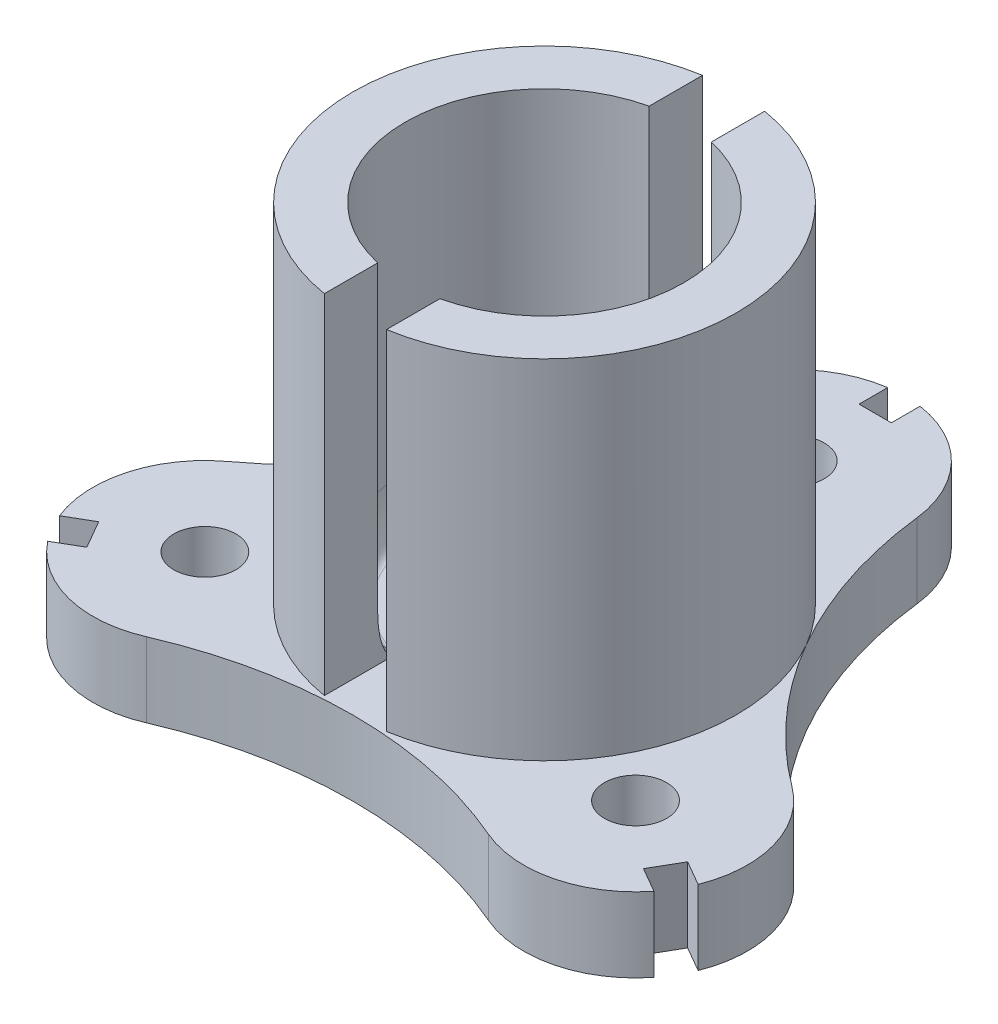
from build123d import *

# Parameters (mm, degrees)
SKETCH1_R           = 1.25
BOSS_EXTRUDE1_DEPTH = 3
SKETCH8_R           = 2.45
SKETCH8_R_2         = 1.85
CUT_EXTRUDE3_DEPTH  = 0.8
CHAMFER4_SIZE       = 0.3
SKETCH9_R           = 3.1
CUT_EXTRUDE4_DEPTH  = 20.810156141
BOSS_EXTRUDE2_DEPTH = 14
CUT_EXTRUDE5_REACH  = 27.931
SKETCH11_W          = 1.3
SKETCH11_H          = 2.4
FILLET1_SIZE        = 0.7
FILLET1_SIZE_2      = 1.8
CUT_EXTRUDE6_REACH  = 26.043


# Some blends are built 0.0001 mm under size
with BuildPart() as part:
    # Sketch1 → Boss-Extrude1 (new body)
    with BuildSketch(Plane(origin=(0, 0, 0), x_dir=(1, 0, 0), z_dir=(0, 1, 0))):
        with BuildLine():
            ThreePointArc((4.470296705, 10.516185401), (0, 14.5), (-4.470296705, 10.516185401))
            ThreePointArc((-4.470296705, 10.516185401), (-6.673163323, 3.852752641), (-11.342432061, -1.386702192))
            ThreePointArc((-11.342432061, -1.386702192), (-12.557368355, -7.25), (-6.872135356, -9.12948321))
            ThreePointArc((-6.872135356, -9.12948321), (0, -7.705505282), (6.872135356, -9.12948321))
            ThreePointArc((6.872135356, -9.12948321), (12.557368355, -7.25), (11.342432061, -1.386702192))
            ThreePointArc((11.342432061, -1.386702192), (6.673163323, 3.852752641), (4.470296705, 10.516185401))
        make_face()
        with Locations(Location((0, 10, 0), (0, 0, 270))):
            Circle(SKETCH1_R, mode=Mode.SUBTRACT)
        with Locations(Location((-8.660254038, -5, 0), (0, 0, 270))):
            Circle(SKETCH1_R, mode=Mode.SUBTRACT)
        with Locations(Location((8.660254038, -5, 0), (0, 0, 270))):
            Circle(SKETCH1_R, mode=Mode.SUBTRACT)
    extrude(amount=BOSS_EXTRUDE1_DEPTH)

    # Sketch8 → Cut-Extrude3 (cut)
    # profile 1 of 3: a face of its own
    with BuildSketch(Plane.XZ):
        with Locations(Location((8.660254038, 5, 0), (0, 0, 270))):
            Circle(SKETCH8_R)
        with Locations(Location((8.660254038, 5, 0), (0, 0, 270))):
            Circle(SKETCH8_R_2, mode=Mode.SUBTRACT)
    # profile 2 of 3: a face of its own
    with BuildSketch(Plane.XZ):
        with Locations(Location((-8.660254038, 5, 0), (0, 0, 270))):
            Circle(SKETCH8_R)
        with Locations(Location((-8.660254038, 5, 0), (0, 0, 270))):
            Circle(SKETCH8_R_2, mode=Mode.SUBTRACT)
    # profile 3 of 3: a face of its own
    with BuildSketch(Plane.XZ):
        with Locations(Location((0, -10, 0), (0, 0, 270))):
            Circle(SKETCH8_R)
        with Locations(Location((0, -10, 0), (0, 0, 270))):
            Circle(SKETCH8_R_2, mode=Mode.SUBTRACT)
    extrude(amount=-CUT_EXTRUDE3_DEPTH, mode=Mode.SUBTRACT)

    # Chamfer4
    chamfer4_edges = [part.edges().sort_by_distance(p)[0] for p in [
        (8.660254038, 0.8, 7.45),
        (8.660254038, 0.8, 6.85),
        (-8.660254038, 0.8, 7.45),
        (-8.660254038, 0.8, 6.85),
        (0, 0.8, -7.55),
        (0, 0.8, -8.15),
        (0, 0, -7.55),
    ]]
    chamfer(chamfer4_edges, length=CHAMFER4_SIZE - 0.0001)  # a hair under: the kernel refuses the full size

    # Sketch9 → Cut-Extrude4 (cut, through all)
    with BuildSketch(Plane(origin=(0, 3, 0), x_dir=(1, 0, 0), z_dir=(0, 1, 0))):
        with Locations(Location((0, 0, 0), (0, 0, 270))):
            Circle(SKETCH9_R)
    extrude(amount=-CUT_EXTRUDE4_DEPTH, mode=Mode.SUBTRACT)

    # Sketch10 → Boss-Extrude2 (add)
    with BuildSketch(Plane(origin=(0, 3, 0), x_dir=(1, 0, 0), z_dir=(0, 1, 0))):
        with BuildLine():
            ThreePointArc((-1.25, 7.603440777), (-7.705505282, 0), (-1.25, -7.603440777))
            Line((-1.25, -7.603440777), (-1.25, -5.458708638))
            ThreePointArc((-1.25, -5.458708638), (-5.6, 0), (-1.25, 5.458708638))
            Line((-1.25, 5.458708638), (-1.25, 7.603440777))
        make_face()
        with BuildLine():
            Line((1.25, -5.458708638), (1.25, -7.603440777))
            ThreePointArc((1.25, -7.603440777), (5.873954939, -4.987129939), (7.705505282, 0))
            ThreePointArc((7.705505282, 0), (5.873954939, 4.987129939), (1.25, 7.603440777))
            Line((1.25, 7.603440777), (1.25, 5.458708638))
            ThreePointArc((1.25, 5.458708638), (4.379497688, 3.489985673), (5.6, 0))
            ThreePointArc((5.6, 0), (4.379497688, -3.489985673), (1.25, -5.458708638))
        make_face()
    extrude(amount=BOSS_EXTRUDE2_DEPTH)

    # Sketch11 → Cut-Extrude5 (cut, up to next)
    with BuildSketch(Plane.XZ, mode=Mode.PRIVATE) as cut_extrude5_sk1:
        Polygon((13.271598839, 8.412916512), (11.19313787, 7.212916512), (11.84313787, 6.087083488), (13.921598839, 7.287083488), align=None)
    cut_extrude5_tool1 = extrude(cut_extrude5_sk1.sketch, amount=-CUT_EXTRUDE5_REACH, mode=Mode.PRIVATE) & part.part
    # Sketch11 → Cut-Extrude5 (cut, up to next)
    with BuildSketch(Plane.XZ, mode=Mode.PRIVATE) as cut_extrude5_sk2:
        Polygon((-13.921598839, 7.287083488), (-11.84313787, 6.087083488), (-11.19313787, 7.212916512), (-13.271598839, 8.412916512), align=None)
    cut_extrude5_tool2 = extrude(cut_extrude5_sk2.sketch, amount=-CUT_EXTRUDE5_REACH, mode=Mode.PRIVATE) & part.part
    # Sketch11 → Cut-Extrude5 (cut, up to next)
    with BuildSketch(Plane.XZ, mode=Mode.PRIVATE) as cut_extrude5_sk3:
        with Locations((0, -14.5)):
            Rectangle(SKETCH11_W, SKETCH11_H)
    cut_extrude5_tool3 = extrude(cut_extrude5_sk3.sketch, amount=-CUT_EXTRUDE5_REACH, mode=Mode.PRIVATE) & part.part
    add(cut_extrude5_tool1.solids().sort_by_distance((12.557368, 0, 7.25))[0], mode=Mode.SUBTRACT)
    add(cut_extrude5_tool2.solids().sort_by_distance((-12.557368, 0, 7.25))[0], mode=Mode.SUBTRACT)
    add(cut_extrude5_tool3.solids().sort_by_distance((0, 0, -14.5))[0], mode=Mode.SUBTRACT)

    # Fillet1
    # an asymmetric fillet: 1.8, 0.7 mm, written as the material it adds along each edge
    with BuildSketch(Plane(origin=(0, 3, 0), x_dir=(0.5475293805867771, 0, 0.8367864586585159), z_dir=(0.8367864586585159, 0, -0.5475293805867771))) as fillet1_piece_1_section:
        with BuildLine():
            Bezier((5.6 - FILLET1_SIZE, 0), (5.6, 0), (5.6, -FILLET1_SIZE_2), weights=[1, 0.707106781, 1])
            Line((5.6, -FILLET1_SIZE_2), (5.6, 0))
            Line((5.6, 0), (5.6 - FILLET1_SIZE, 0))
        make_face()
    fillet1_piece_1 = revolve(axis=Axis((0, 3, 0), (0, -1, 0)), revolution_arc=246.395365409, mode=Mode.PRIVATE)
    fillet1_piece_1 = split(fillet1_piece_1, bisect_by=Plane(origin=(1.25, 3.4101004, 4.981961309), z_dir=(1, 0, 0)), keep=Keep.TOP, mode=Mode.PRIVATE)
    add(fillet1_piece_1)
    with BuildSketch(Plane(origin=(0, 3, 0), x_dir=(0.5475293805867771, 0, 0.8367864586585159), z_dir=(0.8367864586585159, 0, -0.5475293805867771))) as fillet1_piece_2_section:
        with BuildLine():
            Bezier((5.6 - FILLET1_SIZE, 0), (5.6, 0), (5.6, -FILLET1_SIZE_2), weights=[1, 0.707106781, 1])
            Line((5.6, -FILLET1_SIZE_2), (5.6, 0))
            Line((5.6, 0), (5.6 - FILLET1_SIZE, 0))
        make_face()
    fillet1_piece_2 = revolve(axis=Axis((0, 3, 0), (0, -1, 0)), revolution_arc=246.395365409, mode=Mode.PRIVATE)
    fillet1_piece_2 = split(fillet1_piece_2, bisect_by=Plane(origin=(-1.25, 3.521482182, 0), z_dir=(-1, 0, 0)), keep=Keep.TOP, mode=Mode.PRIVATE)
    add(fillet1_piece_2)
    with BuildSketch(Plane(origin=(0, 3, 0), x_dir=(-0.5475293805867888, 0, -0.8367864586585083), z_dir=(-0.8367864586585083, 0, 0.5475293805867888))) as fillet1_piece_3_section:
        with BuildLine():
            Bezier((5.6 - FILLET1_SIZE, 0), (5.6, 0), (5.6, -FILLET1_SIZE_2), weights=[1, 0.707106781, 1])
            Line((5.6, -FILLET1_SIZE_2), (5.6, 0))
            Line((5.6, 0), (5.6 - FILLET1_SIZE, 0))
        make_face()
    fillet1_piece_3 = revolve(axis=Axis((0, 3, 0), (0, -1, 0)), revolution_arc=246.395365409, mode=Mode.PRIVATE)
    fillet1_piece_3 = split(fillet1_piece_3, bisect_by=Plane(origin=(-1.25, 3.4101004, -4.981961309), z_dir=(-1, 0, 0)), keep=Keep.TOP, mode=Mode.PRIVATE)
    add(fillet1_piece_3)
    with BuildSketch(Plane(origin=(0, 3, 0), x_dir=(-0.5475293805867888, 0, -0.8367864586585083), z_dir=(-0.8367864586585083, 0, 0.5475293805867888))) as fillet1_piece_4_section:
        with BuildLine():
            Bezier((5.6 - FILLET1_SIZE, 0), (5.6, 0), (5.6, -FILLET1_SIZE_2), weights=[1, 0.707106781, 1])
            Line((5.6, -FILLET1_SIZE_2), (5.6, 0))
            Line((5.6, 0), (5.6 - FILLET1_SIZE, 0))
        make_face()
    fillet1_piece_4 = revolve(axis=Axis((0, 3, 0), (0, -1, 0)), revolution_arc=246.395365409, mode=Mode.PRIVATE)
    fillet1_piece_4 = split(fillet1_piece_4, bisect_by=Plane(origin=(1.25, 3.521482182, 0), z_dir=(1, 0, 0)), keep=Keep.TOP, mode=Mode.PRIVATE)
    add(fillet1_piece_4)

    # Sketch13 → Cut-Extrude6 (cut, up to next)
    with BuildSketch(Plane(origin=(0, 3, 0), x_dir=(1, 0, 0), z_dir=(0, 1, 0)), mode=Mode.PRIVATE) as cut_extrude6_sk1:
        with BuildLine():
            Line((-1.2, 3.520347662), (-1.2, 2.858321186))
            ThreePointArc((-1.2, 2.858321186), (1.71610023, 2.581666129), (3.1, 0))
            ThreePointArc((3.1, 0), (3.079772307, -0.353556981), (3.019353201, -0.7025))
            ThreePointArc((3.019353201, -0.7025), (3.1918175, -0.112209971), (3.25, 0.5))
            ThreePointArc((3.25, 0.5), (1.825171225, 3.189098362), (-1.2, 3.520347662))
        make_face()
    cut_extrude6_tool1 = extrude(cut_extrude6_sk1.sketch, amount=-CUT_EXTRUDE6_REACH, mode=Mode.PRIVATE) & part.part
    add(cut_extrude6_tool1.solids().sort_by_distance((1.789819, 3, -3.137012))[0], mode=Mode.SUBTRACT)

    # Fillet2
    # an asymmetric fillet: 0.5, 0.4 mm, written as the material it adds along each edge
    with BuildSketch(Plane(origin=(-1.2, 3, -3.520347662), x_dir=(0.9513626370568626, 0, -0.3080732588398615), z_dir=(0, -1, 0))) as fillet2_piece_1:
        with BuildLine():
            Bezier((0.422293635, 0), (0.008719291, -0.026926088), (-0.079374984, 0.245118303), weights=[1, 0.789181232, 1])
            Line((-0.079374984, 0.245118303), (0, 0))
            ThreePointArc((0, 0), (0.211146817, -0.006866173), (0.422293635, 0))
        make_face()
    extrude(amount=3)


solid = part.part
